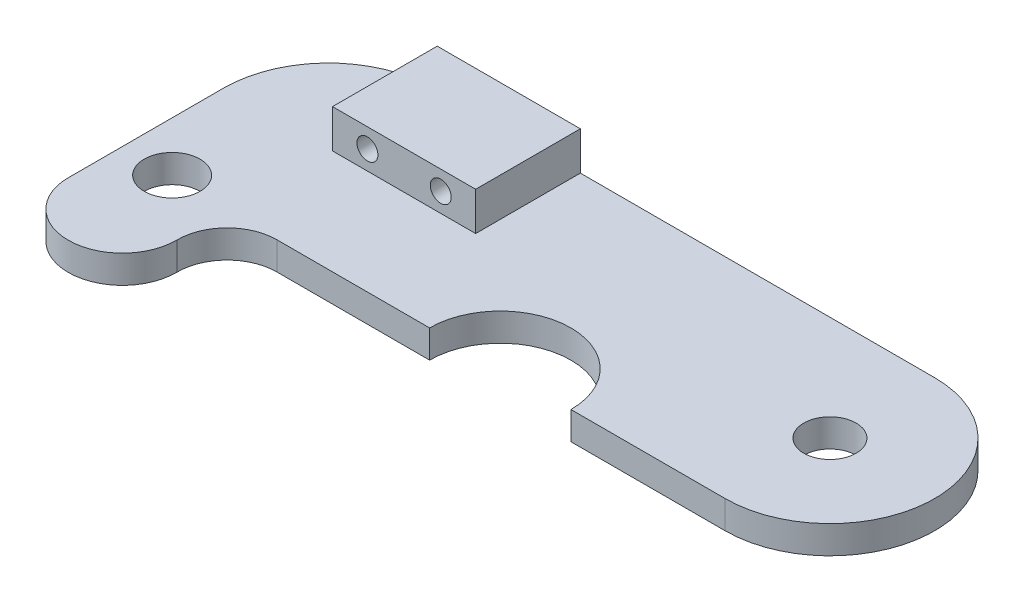
from build123d import *

# Parameters (mm, degrees)
SKETCH1_R           = 15
SKETCH1_R_2         = 16
BOSS_EXTRUDE2_DEPTH = 16
SCALE1_SCALE        = 0.1
SKETCH2_W           = 8.2
SKETCH2_H           = 6
BOSS_EXTRUDE3_DEPTH = 2.2
CUT_EXTRUDE1_REACH  = 31.494
SKETCH3_R           = 0.6


with BuildPart() as part:
    # Sketch1 → Boss-Extrude2 (new body)
    with BuildSketch(Plane(origin=(0, 0, 0), x_dir=(1, 0, 0), z_dir=(0, 1, 0))):
        with BuildLine():
            Line((70.049764714, -40.775229358), (158.449541284, -40.775229358))
            ThreePointArc((158.449541284, -40.775229358), (218.449541284, 19.224770642), (158.449541284, 79.224770642))
            Line((158.449541284, 79.224770642), (-126.550458716, 79.224770642))
            ThreePointArc((-126.550458716, 79.224770642), (-170.522674065, 62.507943227), (-188.950235286, 19.224770642))
            Line((-188.950235286, 19.224770642), (-188.950235286, -40.775229358))
            Line((-188.950235286, -40.775229358), (-188.950235286, -69.775229358))
            ThreePointArc((-188.950235286, -69.775229358), (-157.950235286, -100.775229358), (-126.950235286, -69.775229358))
            Line((-126.950235286, -69.775229358), (-126.950235286, -69.275229358))
            ThreePointArc((-126.950235286, -69.275229358), (-118.60277855, -49.122686094), (-98.450235286, -40.775229358))
            Line((-98.450235286, -40.775229358), (-10.950235286, -40.775229358))
            ThreePointArc((-10.950235286, -40.775229358), (29.549764714, -0.275229358), (70.049764714, -40.775229358))
        make_face()
        with Locations((158.449541284, 19.224770642)):
            Circle(SKETCH1_R, mode=Mode.SUBTRACT)
        with Locations((-160.450235286, -38.775229358)):
            Circle(SKETCH1_R_2, mode=Mode.SUBTRACT)
    extrude(amount=BOSS_EXTRUDE2_DEPTH)


with BuildPart() as part_1:
    # Scale1: scaled about (-1.368635094, 8, -15.337313524)
    add(part.part.scale(SCALE1_SCALE).moved(Location((-1.231771585, 7.2, -13.803582172))))

    # Sketch2 → Boss-Extrude3 (add)
    with BuildSketch(Plane(origin=(0, 8.8, 0), x_dir=(1, 0, 0), z_dir=(0, 1, 0))):
        with Locations((-9.786817456, 18.726059236)):
            Rectangle(SKETCH2_W, SKETCH2_H)
    extrude(amount=BOSS_EXTRUDE3_DEPTH)

    # Sketch3 → Cut-Extrude1 (cut, up to next)
    with BuildSketch(Plane(origin=(0, 0, -21.726059236), x_dir=(-1, 0, 0), z_dir=(0, 0, -1)), mode=Mode.PRIVATE) as cut_extrude1_sk1:
        with Locations((7.686817456, 9.9)):
            Circle(SKETCH3_R)
    cut_extrude1_tool1 = extrude(cut_extrude1_sk1.sketch, amount=-CUT_EXTRUDE1_REACH, mode=Mode.PRIVATE) & part_1.part
    # Sketch3 → Cut-Extrude1 (cut, up to next)
    with BuildSketch(Plane(origin=(0, 0, -21.726059236), x_dir=(-1, 0, 0), z_dir=(0, 0, -1)), mode=Mode.PRIVATE) as cut_extrude1_sk2:
        with Locations((11.886817456, 9.9)):
            Circle(SKETCH3_R)
    cut_extrude1_tool2 = extrude(cut_extrude1_sk2.sketch, amount=-CUT_EXTRUDE1_REACH, mode=Mode.PRIVATE) & part_1.part
    add(cut_extrude1_tool1.solids().sort_by_distance((-7.686817, 9.9, -21.726059))[0], mode=Mode.SUBTRACT)
    add(cut_extrude1_tool2.solids().sort_by_distance((-11.886817, 9.9, -21.726059))[0], mode=Mode.SUBTRACT)


solid = part_1.part
